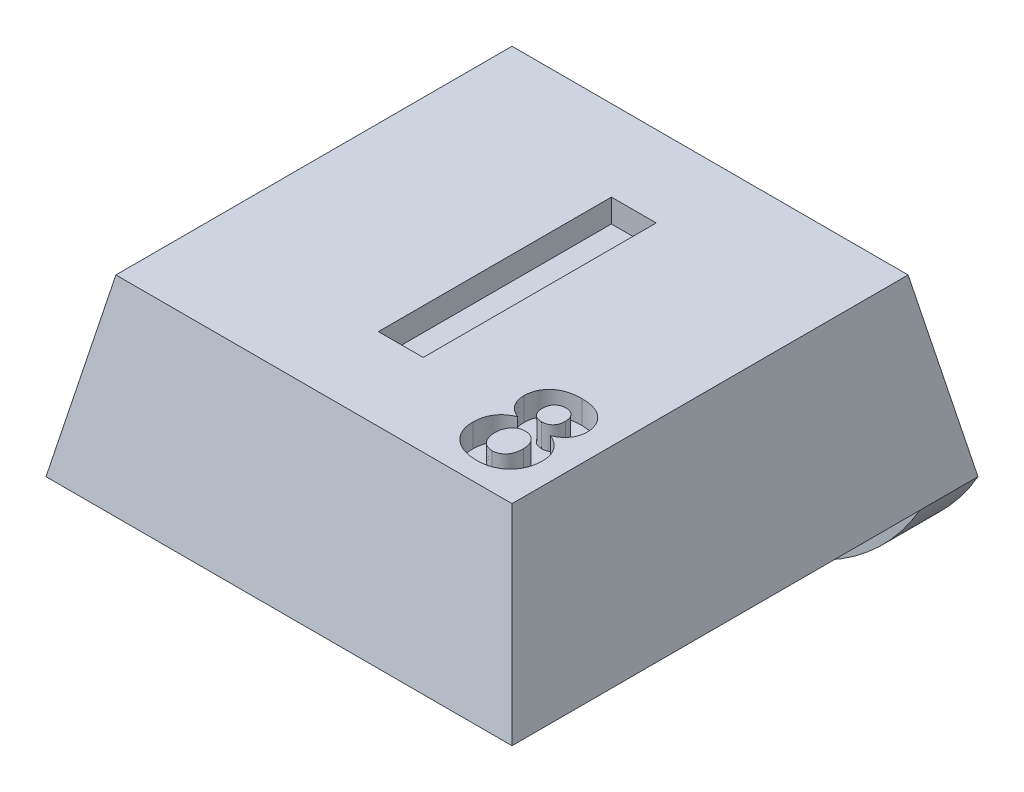
from build123d import *

# Parameters (mm, degrees)
SKETCH1_W               = 8
SKETCH1_H               = 8
BOSS_EXTRUDE1_DEPTH     = 3
CUT_EXTRUDE1_DEPTH      = 12.704699911
CUT_EXTRUDE1_DEPTH_BACK = 12.704699911
CUT_EXTRUDE2_DEPTH      = 11
SKETCH4_R               = 1.8
CUT_EXTRUDE3_DEPTH      = 0.8
SKETCH5_W               = 8
SKETCH5_H               = 1
BOSS_EXTRUDE2_DEPTH     = 2
FILLET1_R               = 4
SKETCH6_W               = 0.769230769
SKETCH6_H               = 4
CUT_EXTRUDE4_DEPTH      = 0.4
CUT_EXTRUDE5_DEPTH      = 0.4


with BuildPart() as part:
    # Sketch1 → Boss-Extrude1 (new body)
    with BuildSketch(Plane(origin=(0, 0, 0), x_dir=(1, 0, 0), z_dir=(0, 1, 0))):
        with Locations((4, 4)):
            Rectangle(SKETCH1_W, SKETCH1_H)
    extrude(amount=BOSS_EXTRUDE1_DEPTH)

    # Sketch2 → Cut-Extrude1 (cut, two sides: drawn at the far end of the back side and taken through both)
    with BuildSketch(Plane.XY.offset(-CUT_EXTRUDE1_DEPTH_BACK)):
        Polygon((0, 0), (0.6, 3), (0, 3), align=None)
        Polygon((8, 0), (7.4, 3), (8, 3), align=None)
    extrude(amount=CUT_EXTRUDE1_DEPTH + CUT_EXTRUDE1_DEPTH_BACK, mode=Mode.SUBTRACT)

    # Sketch3 → Cut-Extrude2 (cut)
    with BuildSketch(Plane(origin=(0, 0, 0), x_dir=(0, 0, -1), z_dir=(1, 0, 0))):
        Polygon((0, 0), (0.6, 3), (0, 3), align=None)
        Polygon((8, 3), (7.4, 3), (8, 0), align=None)
    extrude(amount=CUT_EXTRUDE2_DEPTH, mode=Mode.SUBTRACT)

    # Sketch4 → Cut-Extrude3 (cut)
    with BuildSketch(Plane.XZ):
        with Locations(Location((4, -3.75, 0), (0, 0, 270))):
            Circle(SKETCH4_R)
    extrude(amount=-CUT_EXTRUDE3_DEPTH, mode=Mode.SUBTRACT)

    # Sketch5 → Boss-Extrude2 (add)
    with BuildSketch(Plane.XZ):
        with Locations((4, -7.5)):
            Rectangle(SKETCH5_W, SKETCH5_H)
    extrude(amount=BOSS_EXTRUDE2_DEPTH)

    # Fillet1
    # the kernel refuses this fillet: 4 mm, written as the material it takes off along each edge
    with BuildSketch(Plane(origin=(8, -2, -16.660254038), x_dir=(0, 1, 0), z_dir=(0, 0, 1)), Plane(origin=(0, -2, 1.660254038), x_dir=(0, 1, 0), z_dir=(0, 0, -1))) as fillet1_piece_1:
        with BuildLine():
            CenterArc((4, 3.464101615), FILLET1_R, 180, 60)
            Line((0, 3.464101615), (-0.08, 3.464101615))
            Line((-0.08, 3.464101615), (-0.08, 0))
            Line((-0.08, 0), (0, -0.08))
            ThreePointArc((0, -0.08), (1, -0.08), (1.96, -0.069282032))
            Line((1.96, -0.069282032), (2, 0))
        make_face()
    extrude(amount=18.320508076, mode=Mode.SUBTRACT)

    # Sketch6 → Cut-Extrude4 (cut)
    with BuildSketch(Plane(origin=(0, 3, 0), x_dir=(1, 0, 0), z_dir=(0, 1, 0))):
        with Locations((4.080454652, 4.010567225)):
            Rectangle(SKETCH6_W, SKETCH6_H)
    extrude(amount=-CUT_EXTRUDE4_DEPTH, mode=Mode.SUBTRACT)

    # Sketch7 → Cut-Extrude5 (cut)
    with BuildSketch(Plane(origin=(0, 3, 0), x_dir=(1, 0, 0), z_dir=(0, 1, 0))):
        with BuildLine():
            add(Edge.make_bspline(
                [(6.15651658, 1.940494244), (6.145510655, 1.945154492), (6.123907371, 1.954301988), (6.09323484, 1.970294914), (6.064799566, 1.987351514), (6.03904827, 2.006151328), (6.014913928, 2.025334971), (5.993825771, 2.046858093), (5.974537605, 2.069089397), (5.952535222, 2.100444232), (5.930090229, 2.141832976), (5.910800925, 2.194430822), (5.898811147, 2.249451533), (5.897303934, 2.287068468), (5.896540619, 2.306119244)],
                knots=[0, 0, 0, 0, 0.898135024, 1.762928937, 2.598141881, 3.387992021, 4.158483993, 4.912374357, 5.649344587, 6.368826796, 7.78793972, 9.174346042, 10.568971657, 12, 12, 12, 12], degree=3))
            add(Edge.make_bspline(
                [(5.896540619, 2.306119244), (5.896949128, 2.322245314), (5.897751301, 2.353911386), (5.904281857, 2.400363734), (5.915616882, 2.44465812), (5.931010165, 2.486919818), (5.951038649, 2.526923073), (5.975496438, 2.56462901), (6.003930921, 2.600564872), (6.037294343, 2.633564085), (6.074323927, 2.664052327), (6.115534703, 2.69032529), (6.160485402, 2.712397947), (6.20891965, 2.730972479), (6.261326587, 2.744700346), (6.31723261, 2.754957515), (6.376837021, 2.760515608), (6.417804161, 2.761422579), (6.438848311, 2.761888475)],
                knots=[0, 0, 0, 0, 0.969401132, 1.903571386, 2.813295953, 3.714164367, 4.602979607, 5.497068024, 6.412430398, 7.352730811, 8.313282239, 9.291613189, 10.283859467, 11.320059661, 12.405231593, 13.536450991, 14.734515125, 16, 16, 16, 16], degree=3))
            add(Edge.make_bspline(
                [(6.438848311, 2.761888475), (6.459773562, 2.761431674), (6.500383715, 2.760545149), (6.55961144, 2.754877249), (6.615077261, 2.744816374), (6.667188187, 2.730854406), (6.715469625, 2.712293645), (6.760612767, 2.690551265), (6.801644432, 2.66381705), (6.838966437, 2.633598573), (6.872672652, 2.600569648), (6.901445211, 2.564628122), (6.926343213, 2.527027151), (6.946297666, 2.486906382), (6.961756812, 2.444666111), (6.972933798, 2.400328314), (6.980070192, 2.353946909), (6.98078976, 2.322251495), (6.981156004, 2.306119244)],
                knots=[0, 0, 0, 0, 1.259437241, 2.444221022, 3.576496957, 4.648717845, 5.68588583, 6.685544666, 7.658705287, 8.625770615, 9.572078176, 10.492824823, 11.391686538, 12.281331915, 13.183041723, 14.093615956, 15.029693465, 16, 16, 16, 16], degree=3))
            add(Edge.make_bspline(
                [(6.981156004, 2.306119244), (6.980366305, 2.286090338), (6.978812332, 2.246677396), (6.965258975, 2.189529308), (6.943928318, 2.135551364), (6.913295241, 2.085904697), (6.875370779, 2.040437046), (6.829547075, 2.001047886), (6.777330344, 1.966558185), (6.738534469, 1.949324529), (6.718656004, 1.940494244)],
                knots=[0, 0, 0, 0, 1.001685467, 1.971119642, 2.924446479, 3.896772127, 4.879289176, 5.877460772, 6.912440485, 8, 8, 8, 8], degree=3))
            add(Edge.make_bspline(
                [(6.718656004, 1.940494244), (6.730995791, 1.935383384), (6.755209584, 1.92535458), (6.789618906, 1.907504981), (6.821666519, 1.887953149), (6.85191654, 1.867223707), (6.879208616, 1.843911559), (6.904542812, 1.819378981), (6.927921941, 1.793284607), (6.948603911, 1.76528217), (6.967111811, 1.735846397), (6.983352513, 1.705442361), (6.996740217, 1.673626651), (7.007885734, 1.640992504), (7.016699849, 1.607138887), (7.022574215, 1.572136793), (7.026912363, 1.536034577), (7.0271763, 1.511541428), (7.02730985, 1.49914809)],
                knots=[0, 0, 0, 0, 1.114643742, 2.187213659, 3.231772812, 4.247796845, 5.244764516, 6.224002375, 7.19061506, 8.165938012, 9.126385546, 10.091434554, 11.040068535, 12.004700134, 12.968444139, 13.956586669, 14.966049226, 16, 16, 16, 16], degree=3))
            add(Edge.make_bspline(
                [(7.02730985, 1.49914809), (7.026796446, 1.478937492), (7.025787679, 1.439226454), (7.018711219, 1.38107925), (7.005929874, 1.325952641), (6.988491467, 1.273708162), (6.966746481, 1.223971877), (6.938910841, 1.177706145), (6.906713253, 1.134080082), (6.869643217, 1.093910629), (6.828597293, 1.057517999), (6.784112626, 1.025535606), (6.736110057, 0.99883009), (6.684984255, 0.976556488), (6.630355755, 0.95988295), (6.572607046, 0.947459175), (6.511624372, 0.940305747), (6.469876213, 0.939316226), (6.448583888, 0.938811552)],
                knots=[0, 0, 0, 0, 1.069671731, 2.10175744, 3.09402022, 4.059639235, 5.013663234, 5.960662081, 6.911094837, 7.879078902, 8.847982309, 9.810095429, 10.772776236, 11.750101161, 12.756155452, 13.790512928, 14.873121219, 16, 16, 16, 16], degree=3))
            add(Edge.make_bspline(
                [(6.448583888, 0.938811552), (6.428619193, 0.939272791), (6.389567235, 0.940174998), (6.332155248, 0.945908933), (6.277405474, 0.955949195), (6.225107083, 0.970165993), (6.175193963, 0.987917291), (6.128286945, 1.010684294), (6.083352924, 1.036376334), (6.055949035, 1.05713359), (6.042213696, 1.067537513)],
                knots=[0, 0, 0, 0, 1.102600357, 2.156742264, 3.182669202, 4.172953404, 5.147246686, 6.10327948, 7.049328352, 8, 8, 8, 8], degree=3))
            add(Edge.make_bspline(
                [(6.042213696, 1.067537513), (6.026828749, 1.080378521), (5.996458022, 1.105727373), (5.957746472, 1.14982945), (5.924287717, 1.196787263), (5.897240595, 1.247466884), (5.876140917, 1.301840234), (5.861164702, 1.359548786), (5.851827258, 1.420839433), (5.850875415, 1.46281546), (5.850386773, 1.484364436)],
                knots=[0, 0, 0, 0, 1.009349607, 1.992511403, 2.949479119, 3.912246635, 4.881480856, 5.884237694, 6.913844069, 8, 8, 8, 8], degree=3))
            add(Edge.make_bspline(
                [(5.850386773, 1.484364436), (5.851295235, 1.508227217), (5.853090808, 1.555391937), (5.867205324, 1.624626505), (5.890509398, 1.690664462), (5.91713497, 1.74293756), (5.943357572, 1.782163786), (5.96591762, 1.810161528), (5.991173615, 1.836408274), (6.018927817, 1.861025046), (6.049598606, 1.883490474), (6.082833606, 1.904254883), (6.118388609, 1.923985052), (6.143675127, 1.934933969), (6.15651658, 1.940494244)],
                knots=[0, 0, 0, 0, 1.466730477, 2.898988729, 4.325053486, 5.763136659, 6.492982434, 7.22372602, 7.971323195, 8.73066801, 9.502396106, 10.306304791, 11.139877329, 12, 12, 12, 12], degree=3))
        make_face()
        with BuildLine():
            add(Edge.make_bspline(
                [(6.242694465, 2.279075975), (6.243227056, 2.263511707), (6.244247122, 2.233701597), (6.254423757, 2.191695088), (6.271267591, 2.155002663), (6.294437582, 2.123896005), (6.323817487, 2.099406734), (6.357917342, 2.081867293), (6.396556715, 2.071574989), (6.423640052, 2.070264386), (6.43776658, 2.069580783)],
                knots=[0, 0, 0, 0, 1.15281608, 2.207978909, 3.181172827, 4.129718639, 5.059990565, 5.992992319, 6.953155196, 8, 8, 8, 8], degree=3))
            add(Edge.make_bspline(
                [(6.43776658, 2.069580783), (6.452019198, 2.070240913), (6.479498112, 2.071513639), (6.518435607, 2.08218095), (6.552976359, 2.099808827), (6.582400264, 2.12461233), (6.606163254, 2.155745627), (6.623191809, 2.192513664), (6.633513276, 2.234649719), (6.634488897, 2.264469788), (6.635002157, 2.280157706)],
                knots=[0, 0, 0, 0, 1.048069097, 2.020667378, 2.946900928, 3.882892544, 4.829907216, 5.807806237, 6.846717784, 8, 8, 8, 8], degree=3))
            add(Edge.make_bspline(
                [(6.635002157, 2.280157706), (6.634491926, 2.295013238), (6.633516102, 2.323424602), (6.622970742, 2.363619613), (6.606436408, 2.39945922), (6.582642474, 2.429691049), (6.554089388, 2.454874147), (6.520061906, 2.472182505), (6.481941896, 2.483104081), (6.455033522, 2.484327752), (6.441011773, 2.484965398)],
                knots=[0, 0, 0, 0, 1.120059371, 2.14212559, 3.117108277, 4.081714894, 5.028368956, 5.970787798, 6.942592912, 8, 8, 8, 8], degree=3))
            add(Edge.make_bspline(
                [(6.441011773, 2.484965398), (6.426516896, 2.484322219), (6.398793536, 2.483092056), (6.359460666, 2.472341434), (6.324738063, 2.454466675), (6.295507469, 2.429242148), (6.271712994, 2.39862944), (6.254554233, 2.362905047), (6.244256622, 2.322433946), (6.243229383, 2.293922732), (6.242694465, 2.279075975)],
                knots=[0, 0, 0, 0, 1.078082589, 2.061974896, 3.011033917, 3.963675658, 4.914590949, 5.879605178, 6.895838403, 8, 8, 8, 8], degree=3))
        make_face(mode=Mode.SUBTRACT)
        with BuildLine():
            add(Edge.make_bspline(
                [(6.196540619, 1.517176936), (6.196730477, 1.505629296), (6.197099128, 1.483207057), (6.20046304, 1.450559294), (6.205649554, 1.419730372), (6.21375861, 1.391003719), (6.223316031, 1.363907928), (6.235714339, 1.339167945), (6.249793304, 1.316020987), (6.266412851, 1.295211256), (6.28472227, 1.276705394), (6.303924475, 1.260084604), (6.324524838, 1.246535242), (6.346046028, 1.235062063), (6.368845981, 1.226421032), (6.392712607, 1.220489591), (6.41753513, 1.216100982), (6.434500999, 1.215858569), (6.443175234, 1.215734629)],
                knots=[0, 0, 0, 0, 1.266244622, 2.458687606, 3.596609786, 4.690452447, 5.728949622, 6.743059962, 7.719893583, 8.695837149, 9.65607124, 10.572687906, 11.475837526, 12.354503287, 13.243297811, 14.141816854, 15.049956288, 16, 16, 16, 16], degree=3))
            add(Edge.make_bspline(
                [(6.443175234, 1.215734629), (6.451602181, 1.215902824), (6.468057847, 1.216231266), (6.492249091, 1.219984617), (6.515274313, 1.226176747), (6.537422773, 1.234309167), (6.558086812, 1.245374324), (6.577789165, 1.258506963), (6.596578489, 1.273920235), (6.613783635, 1.292116571), (6.62981085, 1.312188806), (6.643411897, 1.33485558), (6.65555564, 1.35931889), (6.66456557, 1.386236104), (6.67253431, 1.414913473), (6.677108469, 1.44591441), (6.680631417, 1.478875262), (6.68097771, 1.501540921), (6.681156004, 1.51321059)],
                knots=[0, 0, 0, 0, 0.942317584, 1.840104704, 2.730710625, 3.607499931, 4.473808274, 5.346669015, 6.254175223, 7.186360584, 8.144194921, 9.122212144, 10.13877185, 11.193666142, 12.293061794, 13.46493029, 14.694790812, 16, 16, 16, 16], degree=3))
            add(Edge.make_bspline(
                [(6.681156004, 1.51321059), (6.680957439, 1.523435783), (6.680568608, 1.543458845), (6.677255041, 1.572763282), (6.671879045, 1.600628764), (6.664397898, 1.626985973), (6.654573048, 1.6515499), (6.642928518, 1.674710577), (6.628949814, 1.696276432), (6.612613113, 1.715977787), (6.595156277, 1.734014144), (6.576153606, 1.749704056), (6.556004184, 1.763065709), (6.534599532, 1.773990125), (6.512031704, 1.782228962), (6.488523892, 1.78844843), (6.463726194, 1.792153595), (6.446793708, 1.792487039), (6.438127157, 1.792657706)],
                knots=[0, 0, 0, 0, 1.18097333, 2.312592441, 3.401847494, 4.45657129, 5.472467779, 6.453609222, 7.447247299, 8.433973197, 9.406033457, 10.342947316, 11.274909381, 12.193955836, 13.112162788, 14.045055317, 14.999401151, 16, 16, 16, 16], degree=3))
            add(Edge.make_bspline(
                [(6.438127157, 1.792657706), (6.428259379, 1.792365239), (6.40916153, 1.791799208), (6.381426866, 1.787876586), (6.355713318, 1.780917675), (6.331705458, 1.771700183), (6.309770612, 1.759227348), (6.289908926, 1.74391846), (6.271697391, 1.726251639), (6.250860821, 1.699090969), (6.229093216, 1.662568124), (6.210711059, 1.615600245), (6.198388998, 1.567087579), (6.197157628, 1.533837656), (6.196540619, 1.517176936)],
                knots=[0, 0, 0, 0, 0.864439711, 1.673014741, 2.446909759, 3.19383146, 3.919980361, 4.648644137, 5.385779273, 6.135663785, 7.641703236, 9.092511638, 10.543128981, 12, 12, 12, 12], degree=3))
        make_face(mode=Mode.SUBTRACT)
    extrude(amount=-CUT_EXTRUDE5_DEPTH, mode=Mode.SUBTRACT)


solid = part.part
